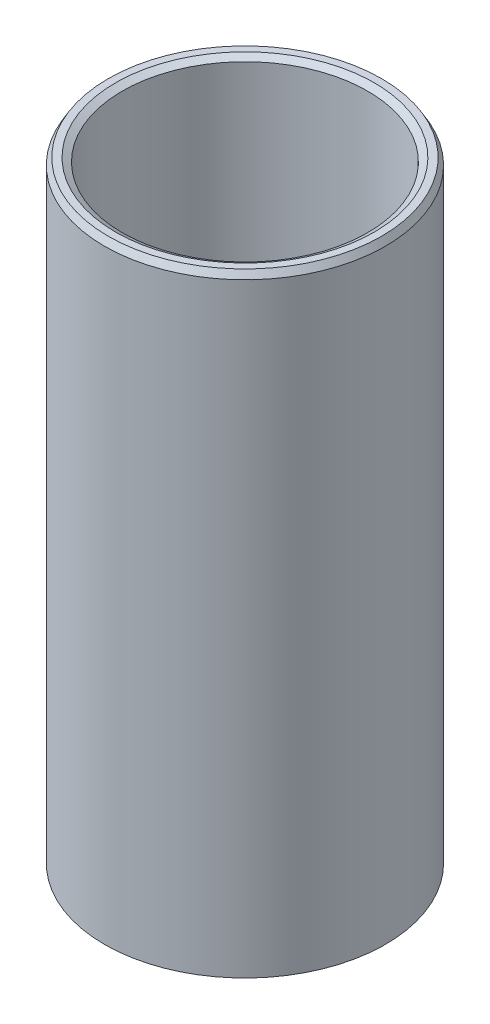
from build123d import *
from OCP.BRepFilletAPI import BRepFilletAPI_MakeChamfer

# Parameters (mm, degrees)
SKETCH1_R           = 57.5
BOSS_EXTRUDE1_DEPTH = 251.845150541
SKETCH2_R           = 50.224500962
CUT_EXTRUDE1_DEPTH  = 265.647841198
CHAMFER1_SIZE       = 2.73102128
CHAMFER1_SIZE2      = 1.576755871


with BuildPart() as part:
    # Sketch1 → Boss-Extrude1 (new body)
    with BuildSketch(Plane(origin=(0, 0, 0), x_dir=(1, 0, 0), z_dir=(0, 1, 0))):
        Circle(SKETCH1_R)
    extrude(amount=BOSS_EXTRUDE1_DEPTH)

    # Sketch2 → Cut-Extrude1 (cut, through all)
    with BuildSketch(Plane(origin=(0, 0, 0), x_dir=(1, 0, 0), z_dir=(0, 1, 0))):
        Circle(SKETCH2_R)
    extrude(amount=CUT_EXTRUDE1_DEPTH, mode=Mode.SUBTRACT)

    # Chamfer1: one chamfer whose edges measure the first distance from different faces: ONE call of the kernel's chamfer builder (chamfer() names one face for all edges)
    chamfer1_edges_1 = [part.edges().sort_by_distance(p)[0] for p in [
        (-50.224500962, 251.845150541, 0),
    ]]
    chamfer1_side_1 = [part.faces().sort_by_distance(p)[0] for p in [
        (-55.873654403, 251.845150541, 0),
    ]]
    chamfer1_edges_2 = [part.edges().sort_by_distance(p)[0] for p in [
        (-50.224500962, 0, 0),
    ]]
    chamfer1_side_2 = [part.faces().sort_by_distance(p)[0] for p in [
        (-50.224500962, 125.92257527, 0),
    ]]
    chamfer1_edges_3 = [part.edges().sort_by_distance(p)[0] for p in [
        (-57.5, 0, 0),
    ]]
    chamfer1_side_3 = [part.faces().sort_by_distance(p)[0] for p in [
        (-55.873654403, 0, 0),
    ]]
    chamfer1_edges_4 = [part.edges().sort_by_distance(p)[0] for p in [
        (-57.5, 251.845150541, 0),
    ]]
    chamfer1_side_4 = [part.faces().sort_by_distance(p)[0] for p in [
        (-57.5, 125.92257527, 0),
    ]]
    chamfer1 = BRepFilletAPI_MakeChamfer(part.part.solid().wrapped)
    for e in chamfer1_edges_1:
        chamfer1.Add(CHAMFER1_SIZE, CHAMFER1_SIZE2, e.wrapped, chamfer1_side_1[0].wrapped)  # the first distance lies on this face
    for e in chamfer1_edges_2:
        chamfer1.Add(CHAMFER1_SIZE, CHAMFER1_SIZE2, e.wrapped, chamfer1_side_2[0].wrapped)  # the first distance lies on this face
    for e in chamfer1_edges_3:
        chamfer1.Add(CHAMFER1_SIZE, CHAMFER1_SIZE2, e.wrapped, chamfer1_side_3[0].wrapped)  # the first distance lies on this face
    for e in chamfer1_edges_4:
        chamfer1.Add(CHAMFER1_SIZE, CHAMFER1_SIZE2, e.wrapped, chamfer1_side_4[0].wrapped)  # the first distance lies on this face
    add(Compound.cast(chamfer1.Shape()), mode=Mode.REPLACE)


solid = part.part
